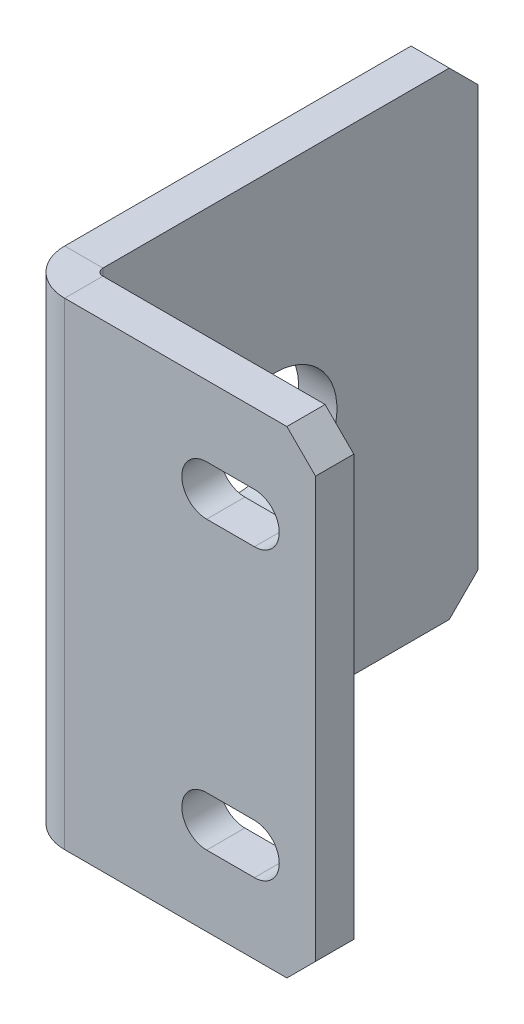
from build123d import *

# Parameters (mm, degrees)
SM_BASE_FLANGE_1_DEPTH = 50
SKETCH_3_R             = 6.5
CUT_EXTRUDE_2_DEPTH    = 74.464277033
CHAMFER_1_SIZE         = 3
CUT_EXTRUDE_3_DEPTH    = 74.464277033
PATTERN_LINEAR_1_COUNT = 2
PATTERN_LINEAR_1_PITCH = 30


# Sheet-metal steps are written as plain solids
with BuildPart() as part:
    # Sketch 1 → 基材-凸緣1 (new body)
    with BuildSketch(Plane(origin=(0, 0, 0), x_dir=(1, 0, 0), z_dir=(0, 1, 0))):
        with BuildLine():
            Line((31, 0), (4.7366, 0))
            ThreePointArc((4.7366, 0), (1.38731802, 1.38731802), (0, 4.7366))
            Line((0, 4.7366), (0, 44))
            Line((0, 44), (4, 44))
            Line((4, 44), (4, 4.7366))
            ThreePointArc((4, 4.7366), (4.215745145, 4.215745145), (4.7366, 4))
            Line((4.7366, 4), (31, 4))
            Line((31, 4), (31, 0))
        make_face()
    extrude(amount=SM_BASE_FLANGE_1_DEPTH)

    # Sketch 3 → 除料-伸長2 (cut, through all)
    with BuildSketch(Plane.ZY):
        with Locations((-22.7366, 25)):
            Circle(SKETCH_3_R)
    extrude(amount=-CUT_EXTRUDE_2_DEPTH, mode=Mode.SUBTRACT)

    # 導角1
    chamfer_1_edges = [part.edges().sort_by_distance(p)[0] for p in [
        (31, 50, -2),
        (31, 0, -2),
        (2, 50, -44),
        (2, 0, -44),
    ]]
    chamfer(chamfer_1_edges, length=CHAMFER_1_SIZE)

    # 草圖4 → 除料-伸長3 (cut, through all)
    with BuildSketch(Plane.XY):
        with BuildLine():
            Line((24.6, 7.4), (19.6, 7.4))
            ThreePointArc((19.6, 7.4), (17, 10), (19.6, 12.6))
            Line((19.6, 12.6), (24.6, 12.6))
            ThreePointArc((24.6, 12.6), (27.2, 10), (24.6, 7.4))
        make_face()
    cut_extrude_3 = extrude(amount=-CUT_EXTRUDE_3_DEPTH, mode=Mode.SUBTRACT)

    # 直線複製排列1: 除料-伸長3 ×2
    with Locations(*[(0, i * PATTERN_LINEAR_1_PITCH, 0) for i in range(1, PATTERN_LINEAR_1_COUNT)]):
        add(cut_extrude_3, mode=Mode.SUBTRACT)


solid = part.part
